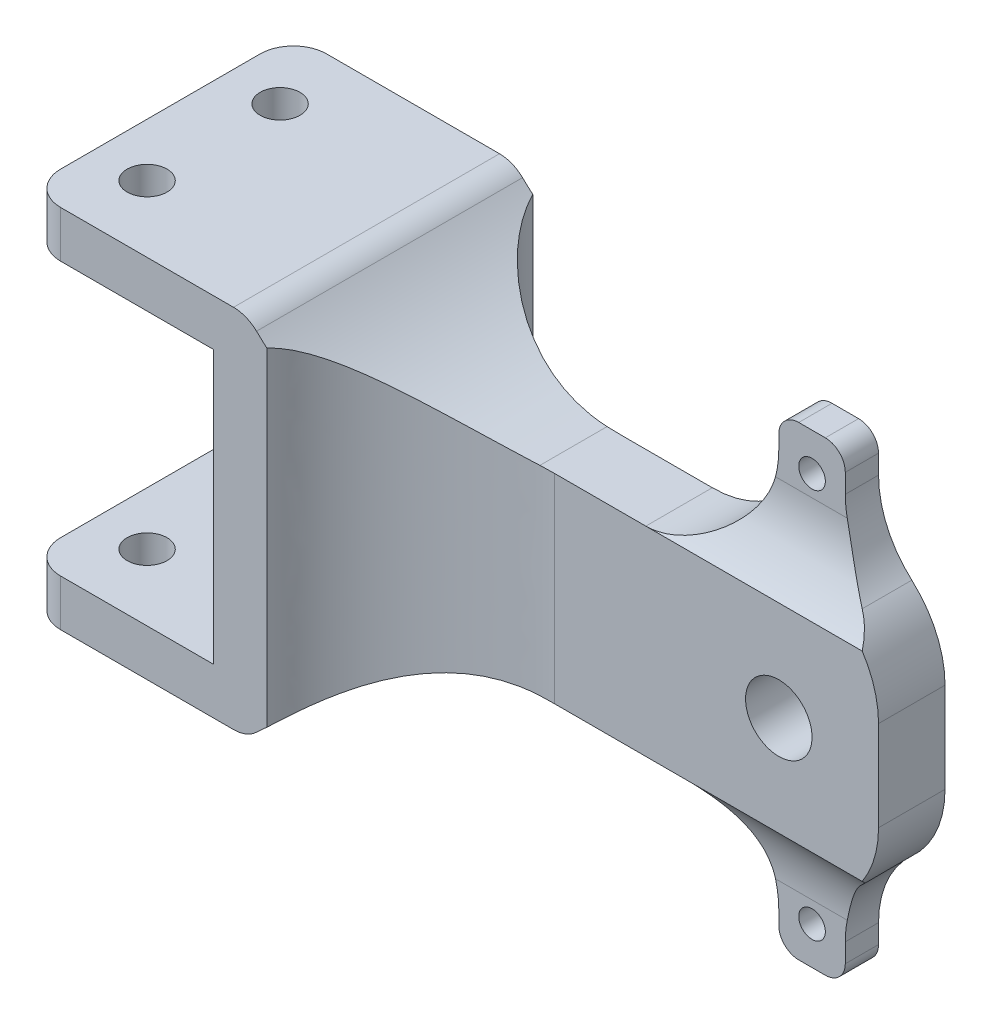
from build123d import *

# Parameters (mm, degrees)
SKETCH_1_W             = 85
SKETCH_1_H             = 30
EXTRUDE_1_DEPTH        = 10
CUT_EXTRUDE_1_REACH    = 92.692
SKETCH_2_R             = 5
EXTRUDE_2_DEPTH        = 15
EXTRUDE_2_DEPTH_BACK   = 25
SKETCH_3_W             = 8
SKETCH_3_H             = 30
SKETCH_5_W             = 8
SKETCH_5_H             = 40
EXTRUDE_3_DEPTH        = 12.5
SKETCH_6_W             = 40
SKETCH_6_H             = 7
EXTRUDE_4_DEPTH        = 28
CUT_EXTRUDE_2_REACH    = 100.266
SKETCH_7_R             = 3
FILLET_1_R             = 5
FILLET_1_OF_MIRROR_1_R = 5
FILLET_2_DEPTH         = 30
FILLET_3_DEPTH         = 30
FILLET_START           = 1e-07
FILLET_4_DEPTH         = 9.9999998
FILLET_START_2         = -15
FILLET_4_2_DEPTH       = 40
FILLET_START_3         = -11.111111111
FILLET_4_3_DEPTH       = 52.222222222
SKETCH_8_W             = 10
SKETCH_8_H             = 5
EXTRUDE_5_DEPTH        = 20
FILLET_5_R             = 15
SKETCH_9_R             = 2
CUT_EXTRUDE_3_DEPTH    = 20
FILLET_6_R             = 3
FILLET_6_OF_MIRROR_3_R = 3
FILLET_7_R             = 15
FILLET_8_R             = 15


with BuildPart() as part:
    # 草图1 → 凸台-拉伸1 (new body)
    with BuildSketch(Plane.XY):
        with Locations((42.5, 15)):
            Rectangle(SKETCH_1_W, SKETCH_1_H)
    extrude(amount=EXTRUDE_1_DEPTH)

    # 草图2 → 切除-拉伸1 (cut, up to next)
    with BuildSketch(Plane(origin=(0, 0, 0), x_dir=(-1, 0, 0), z_dir=(0, 0, -1)), mode=Mode.PRIVATE) as cut_extrude_1_sk1:
        with Locations((-70, 15)):
            Circle(SKETCH_2_R)
    cut_extrude_1_tool1 = extrude(cut_extrude_1_sk1.sketch, amount=-CUT_EXTRUDE_1_REACH, mode=Mode.PRIVATE) & part.part
    add(cut_extrude_1_tool1.solids().sort_by_distance((70, 15, 0))[0], mode=Mode.SUBTRACT)



with BuildPart() as body_2:
    # 草图3 → 凸台-拉伸2 (new, two sides: drawn at the far end of the back side and taken through both)
    with BuildSketch(Plane.XY.offset(10).offset(-EXTRUDE_2_DEPTH_BACK)):
        with Locations((4, 15)):
            Rectangle(SKETCH_3_W, SKETCH_3_H)
    extrude(amount=EXTRUDE_2_DEPTH + EXTRUDE_2_DEPTH_BACK)


with BuildPart() as part_1:
    add(part.part)

    add(body_2.part)  # 凸台-拉伸3 merges body 2
    # 草图5 → 凸台-拉伸3 (add)
    with BuildSketch(Plane(origin=(0, 30, 0), x_dir=(1, 0, 0), z_dir=(0, 1, 0))):
        with Locations((4, -5)):
            Rectangle(SKETCH_5_W, SKETCH_5_H)
    extrude_3 = extrude(amount=EXTRUDE_3_DEPTH)

    # 草图6 → 凸台-拉伸4 (add)
    with BuildSketch(Plane.ZY):
        with Locations((5, 39)):
            Rectangle(SKETCH_6_W, SKETCH_6_H)
    extrude_4 = extrude(amount=EXTRUDE_4_DEPTH)

    # 草图7 → 切除-拉伸2 (cut, up to next)
    with BuildSketch(Plane(origin=(0, 42.5, 0), x_dir=(1, 0, 0), z_dir=(0, 1, 0)), mode=Mode.PRIVATE) as cut_extrude_2_sk1:
        with Locations(Location((-20, 5, 0), (0, 0, 270))):
            Circle(SKETCH_7_R)
    cut_extrude_2_tool1 = extrude(cut_extrude_2_sk1.sketch, amount=-CUT_EXTRUDE_2_REACH, mode=Mode.PRIVATE) & part_1.part
    # 草图7 → 切除-拉伸2 (cut, up to next)
    with BuildSketch(Plane(origin=(0, 42.5, 0), x_dir=(1, 0, 0), z_dir=(0, 1, 0)), mode=Mode.PRIVATE) as cut_extrude_2_sk2:
        with Locations(Location((-20, -15, 0), (0, 0, 270))):
            Circle(SKETCH_7_R)
    cut_extrude_2_tool2 = extrude(cut_extrude_2_sk2.sketch, amount=-CUT_EXTRUDE_2_REACH, mode=Mode.PRIVATE) & part_1.part
    cut_extrude_2_1 = cut_extrude_2_tool1.solids().sort_by_distance((-20, 42.5, -5))[0]
    add(cut_extrude_2_1, mode=Mode.SUBTRACT)
    cut_extrude_2_2 = cut_extrude_2_tool2.solids().sort_by_distance((-20, 42.5, 15))[0]
    add(cut_extrude_2_2, mode=Mode.SUBTRACT)
    cut_extrude_2 = cut_extrude_2_1 + cut_extrude_2_2  # 切除-拉伸2 as one shape, for the pattern or mirror that repeats it

    # 圆角1
    fillet_1_edges = [part_1.edges().sort_by_distance(p)[0] for p in [
        (8, 42.5, 5),
        (-28, 39, -15),
        (-28, 39, 25),
    ]]
    fillet(fillet_1_edges, radius=FILLET_1_R)

    # 镜向1: 凸台-拉伸3, 凸台-拉伸4, 切除-拉伸2 across plane
    add(extrude_3.mirror(Plane.ZX.offset(15)))
    add(extrude_4.mirror(Plane.ZX.offset(15)))
    add(cut_extrude_2.mirror(Plane.ZX.offset(15)), mode=Mode.SUBTRACT)

    # 圆角1 of 镜向1
    fillet_1_of_mirror_1_edges = [part_1.edges().sort_by_distance(p)[0] for p in [
        (8, -12.5, 5),
        (-28, -9, -15),
        (-28, -9, 25),
    ]]
    fillet(fillet_1_of_mirror_1_edges, radius=FILLET_1_OF_MIRROR_1_R)

    # 圆角2: read off the stored shape, not the designer's step
    # 圆角2 outline → 圆角2 (add)
    with BuildSketch(Plane(origin=(0, 0, 0), x_dir=(1, 0, 0), z_dir=(0, 1, 0))):
        with BuildLine():
            add(Edge.make_bspline(
                [(36.284271247, -10), (13.303300859, -10), (8, -25)],
                knots=[0, 0, 0, 1, 1, 1], degree=2, weights=[1, 0.816496581, 1]))
            Line((36.284271247, -10), (8, -10))
            Line((8, -10), (8, -25))
        make_face()
    extrude(amount=FILLET_2_DEPTH)

    # 圆角3: read off the stored shape, not the designer's step
    # 圆角3 outline → 圆角3 (add)
    with BuildSketch(Plane(origin=(0, 0, 0), x_dir=(1, 0, 0), z_dir=(0, 1, 0))):
        with BuildLine():
            Line((8, 0), (36.284271247, 0))
            add(Edge.make_bspline(
                [(36.284271247, 0), (13.303300859, 0), (8, 15)],
                knots=[0, 0, 0, 1, 1, 1], degree=2, weights=[1, 0.816496581, 1]))
            Line((8, 15), (8, 0))
        make_face()
    extrude(amount=FILLET_3_DEPTH)

    # 圆角4: read off the stored shape, not the designer's step
    # 圆角4 outline → 圆角4 (add)
    with BuildSketch(Plane.XY.offset(FILLET_START)):
        with BuildLine():
            ThreePointArc((6.458305444, -11.111111111), (19.217640107, -2.881566512), (34.124772621, 0))
            Line((34.124772621, 0), (8, 0))
            Line((8, 0), (8, -7.5))
            ThreePointArc((8, -7.5), (7.598452306, -9.463220922), (6.458305444, -11.111111111))
        make_face()
        with BuildLine():
            ThreePointArc((34.124772621, 30), (19.217640107, 32.881566512), (6.458305444, 41.111111111))
            ThreePointArc((6.458305444, 41.111111111), (7.598452306, 39.463220922), (8, 37.5))
            Line((8, 37.5), (8, 30))
            Line((8, 30), (34.124772621, 30))
        make_face()
    extrude(amount=FILLET_4_DEPTH)

    # Fillet 4 2 outline → Fillet 4 2 (add)
    with BuildSketch(Plane.XY.offset(FILLET_START_2)):
        with BuildLine():
            ThreePointArc((6.458305444, -11.111111111), (19.217640107, -2.881566512), (34.124772621, 0))
            Line((34.124772621, 0), (8, 0))
            Line((8, 0), (8, -7.5))
            ThreePointArc((8, -7.5), (7.598452306, -9.463220922), (6.458305444, -11.111111111))
        make_face()
        with BuildLine():
            ThreePointArc((34.124772621, 30), (19.217640107, 32.881566512), (6.458305444, 41.111111111))
            ThreePointArc((6.458305444, 41.111111111), (7.598452306, 39.463220922), (8, 37.5))
            Line((8, 37.5), (8, 30))
            Line((8, 30), (34.124772621, 30))
        make_face()
    extrude(amount=FILLET_4_2_DEPTH)

    # Fillet 4 3 outline → Fillet 4 3 (cut)
    with BuildSketch(Plane(origin=(0, 0, 0), x_dir=(1, 0, 0), z_dir=(0, 1, 0)).offset(FILLET_START_3)):
        with BuildLine():
            Line((36, -25), (36, -10.000861536))
            add(Edge.make_bspline(
                [(36, -10.000861536), (13.254227526, -10.138800347), (8, -25)],
                knots=[0.007568185, 0.007568185, 0.007568185, 1, 1, 1], degree=2, weights=[0.997243446, 0.817885369, 1]))
            Line((8, -25), (36, -25))
        make_face()
        with BuildLine():
            add(Edge.make_bspline(
                [(36, 0.000861536), (13.254227526, 0.138800347), (8, 15)],
                knots=[0.007568185, 0.007568185, 0.007568185, 1, 1, 1], degree=2, weights=[0.997243446, 0.817885369, 1]))
            Line((36, 0.000861536), (36, 15))
            Line((36, 15), (8, 15))
        make_face()
    extrude(amount=FILLET_4_3_DEPTH, mode=Mode.SUBTRACT)

    # 草图8 → 凸台-拉伸5 (add)
    with BuildSketch(Plane(origin=(0, 30, 0), x_dir=(1, 0, 0), z_dir=(0, 1, 0))):
        with Locations((70, -2.5)):
            Rectangle(SKETCH_8_W, SKETCH_8_H)
    extrude_5 = extrude(amount=EXTRUDE_5_DEPTH)

    # 圆角5
    # the kernel refuses this fillet: 15 mm, written as the material it adds along each edge
    with BuildSketch(Plane(origin=(65, 30, 5), x_dir=(-1, 0, 0), z_dir=(0, 0, -1))) as fillet_5_piece_1:
        with BuildLine():
            CenterArc((FILLET_5_R, FILLET_5_R), FILLET_5_R, 180, 90)
            Line((0, FILLET_5_R), (-FILLET_5_R * 0.02, FILLET_5_R))
            Line((-FILLET_5_R * 0.02, FILLET_5_R), (-FILLET_5_R * 0.02, -FILLET_5_R * 0.02))
            Line((-FILLET_5_R * 0.02, -FILLET_5_R * 0.02), (FILLET_5_R, -FILLET_5_R * 0.02))
            Line((FILLET_5_R, -FILLET_5_R * 0.02), (FILLET_5_R, 0))
        make_face()
    extrude(amount=5)
    with BuildSketch(Plane(origin=(75, 30, 0), x_dir=(1, 0, 0), z_dir=(0, 0, 1))) as fillet_5_piece_2:
        with BuildLine():
            CenterArc((15, 14.142135624), FILLET_5_R, 180, 70.528779366)
            Line((0, 14.142135624), (-0.3, 14.142135624))
            Line((-0.3, 14.142135624), (-0.3, 0))
            Line((-0.3, 0), (0, -0.3))
            ThreePointArc((0, -0.3), (5, -0.3), (9.9, -0.282842712))
            Line((9.9, -0.282842712), (10, 0))
        make_face()
    extrude(amount=5)
    with BuildSketch(Plane(origin=(75, 30, 5), x_dir=(0, 0, 1), z_dir=(-1, 0, 0))) as fillet_5_piece_3:
        with BuildLine():
            CenterArc((15, 11.180339887), FILLET_5_R, 180, 48.189685104)
            Line((0, 11.180339887), (-0.3, 11.180339887))
            Line((-0.3, 11.180339887), (-0.3, 0))
            Line((-0.3, 0), (0, -0.3))
            ThreePointArc((0, -0.3), (2.5, -0.3), (4.8, -0.223606798))
            Line((4.8, -0.223606798), (5, 0))
        make_face()
    extrude(amount=10)
    with BuildSketch(Plane(origin=(65, 30, 42.5), x_dir=(-1, 0, 0), z_dir=(0, 0, -1))) as fillet_5_piece_4a_section:
        with BuildLine():
            CenterArc((FILLET_5_R, FILLET_5_R), FILLET_5_R, 180, 90)
            Line((0, FILLET_5_R), (-FILLET_5_R * 0.02, FILLET_5_R))
            Line((-FILLET_5_R * 0.02, FILLET_5_R), (-FILLET_5_R * 0.02, -FILLET_5_R * 0.02))
            Line((-FILLET_5_R * 0.02, -FILLET_5_R * 0.02), (FILLET_5_R, -FILLET_5_R * 0.02))
            Line((FILLET_5_R, -FILLET_5_R * 0.02), (FILLET_5_R, 0))
        make_face()
    fillet_5_piece_4a = extrude(amount=42.5, mode=Mode.PRIVATE)
    fillet_5_piece_4a = split(fillet_5_piece_4a, bisect_by=Plane(origin=(65, 30, 10), z_dir=(0, 0, -1)), keep=Keep.TOP, mode=Mode.PRIVATE)
    fillet_5_piece_4a = split(fillet_5_piece_4a, bisect_by=Plane(origin=(65, 30, 5), z_dir=(0, 0, 1)), keep=Keep.TOP, mode=Mode.PRIVATE)
    with BuildSketch(Plane(origin=(75, 30, 5), x_dir=(0, 0, 1), z_dir=(-1, 0, 0))) as fillet_5_piece_4b_section:
        with BuildLine():
            CenterArc((15, 11.180339887), FILLET_5_R, 180, 48.189685104)
            Line((0, 11.180339887), (-0.3, 11.180339887))
            Line((-0.3, 11.180339887), (-0.3, 0))
            Line((-0.3, 0), (0, -0.3))
            ThreePointArc((0, -0.3), (2.5, -0.3), (4.8, -0.223606798))
            Line((4.8, -0.223606798), (5, 0))
        make_face()
    fillet_5_piece_4b = extrude(amount=37.950849719, mode=Mode.PRIVATE)
    fillet_5_piece_4b = split(fillet_5_piece_4b, bisect_by=Plane(origin=(65, 30, 5), z_dir=(-1, 0, 0)), keep=Keep.TOP, mode=Mode.PRIVATE)
    fillet_5_piece_4 = fillet_5_piece_4a & fillet_5_piece_4b
    add(fillet_5_piece_4)
    with BuildSketch(Plane(origin=(102.950849719, 30, 5), x_dir=(0, 0, 1), z_dir=(-1, 0, 0))) as fillet_5_piece_5a_section:
        with BuildLine():
            CenterArc((15, 11.180339887), FILLET_5_R, 180, 48.189685104)
            Line((0, 11.180339887), (-0.3, 11.180339887))
            Line((-0.3, 11.180339887), (-0.3, 0))
            Line((-0.3, 0), (0, -0.3))
            ThreePointArc((0, -0.3), (2.5, -0.3), (4.8, -0.223606798))
            Line((4.8, -0.223606798), (5, 0))
        make_face()
    fillet_5_piece_5a = extrude(amount=37.950849719, mode=Mode.PRIVATE)
    fillet_5_piece_5a = split(fillet_5_piece_5a, bisect_by=Plane(origin=(85, 30, 5), z_dir=(-1, 0, 0)), keep=Keep.TOP, mode=Mode.PRIVATE)
    fillet_5_piece_5a = split(fillet_5_piece_5a, bisect_by=Plane(origin=(75, 30, 5), z_dir=(1, 0, 0)), keep=Keep.TOP, mode=Mode.PRIVATE)
    with BuildSketch(Plane(origin=(75, 30, 0), x_dir=(1, 0, 0), z_dir=(0, 0, 1))) as fillet_5_piece_5b_section:
        with BuildLine():
            CenterArc((15, 14.142135624), FILLET_5_R, 180, 70.528779366)
            Line((0, 14.142135624), (-0.3, 14.142135624))
            Line((-0.3, 14.142135624), (-0.3, 0))
            Line((-0.3, 0), (0, -0.3))
            ThreePointArc((0, -0.3), (5, -0.3), (9.9, -0.282842712))
            Line((9.9, -0.282842712), (10, 0))
        make_face()
    fillet_5_piece_5b = extrude(amount=40.355339059, mode=Mode.PRIVATE)
    fillet_5_piece_5b = split(fillet_5_piece_5b, bisect_by=Plane(origin=(75, 30, 10), z_dir=(0, 0, -1)), keep=Keep.TOP, mode=Mode.PRIVATE)
    fillet_5_piece_5b = split(fillet_5_piece_5b, bisect_by=Plane(origin=(75, 30, 5), z_dir=(0, 0, 1)), keep=Keep.TOP, mode=Mode.PRIVATE)
    fillet_5_piece_5 = fillet_5_piece_5a & fillet_5_piece_5b
    add(fillet_5_piece_5)

    # 草图9 → 切除-拉伸3 (cut)
    with BuildSketch(Plane.XY.offset(5)):
        with Locations((70, 44.33)):
            Circle(SKETCH_9_R)
    cut_extrude_3 = extrude(amount=-CUT_EXTRUDE_3_DEPTH, mode=Mode.SUBTRACT)

    # 圆角6
    fillet_6_edges = [part_1.edges().sort_by_distance(p)[0] for p in [
        (65, 50, 2.5),
        (75, 50, 2.5),
    ]]
    fillet(fillet_6_edges, radius=FILLET_6_R)

    # 镜向3: 凸台-拉伸5, 切除-拉伸3 across plane
    add(extrude_5.mirror(Plane.ZX.offset(15)))
    add(cut_extrude_3.mirror(Plane.ZX.offset(15)), mode=Mode.SUBTRACT)

    # 圆角6 of 镜向3
    fillet_6_of_mirror_3_edges = [part_1.edges().sort_by_distance(p)[0] for p in [
        (65, -20, 2.5),
        (75, -20, 2.5),
    ]]
    fillet(fillet_6_of_mirror_3_edges, radius=FILLET_6_OF_MIRROR_3_R)

    # 圆角7
    # the kernel refuses this fillet: 15 mm, written as the material it adds along each edge
    with BuildSketch(Plane(origin=(65, 0, 5), x_dir=(-1, 0, 0), z_dir=(0, 0, -1))) as fillet_7_piece_1:
        with BuildLine():
            CenterArc((FILLET_7_R, -FILLET_7_R), FILLET_7_R, 90, 90)
            Line((0, -FILLET_7_R), (-FILLET_7_R * 0.02, -FILLET_7_R))
            Line((-FILLET_7_R * 0.02, -FILLET_7_R), (-FILLET_7_R * 0.02, FILLET_7_R * 0.02))
            Line((-FILLET_7_R * 0.02, FILLET_7_R * 0.02), (FILLET_7_R, FILLET_7_R * 0.02))
            Line((FILLET_7_R, FILLET_7_R * 0.02), (FILLET_7_R, 0))
        make_face()
    extrude(amount=5)
    with BuildSketch(Plane(origin=(75, 0, 0), x_dir=(0, -1, 0), z_dir=(0, 0, 1))) as fillet_7_piece_2:
        with BuildLine():
            CenterArc((14.142135624, 15), FILLET_7_R, 199.471220634, 70.528779366)
            Line((0, 10), (-0.282842712, 9.9))
            ThreePointArc((-0.282842712, 9.9), (-0.3, 5), (-0.3, 0))
            Line((-0.3, 0), (0, -0.3))
            Line((0, -0.3), (14.142135624, -0.3))
            Line((14.142135624, -0.3), (14.142135624, 0))
        make_face()
    extrude(amount=5)
    with BuildSketch(Plane(origin=(75, 0, 5), x_dir=(0, 0, 1), z_dir=(-1, 0, 0))) as fillet_7_piece_3:
        with BuildLine():
            CenterArc((15, -11.180339887), FILLET_7_R, 131.810314896, 48.189685104)
            Line((0, -11.180339887), (-0.3, -11.180339887))
            Line((-0.3, -11.180339887), (-0.3, 0))
            Line((-0.3, 0), (0, 0.3))
            ThreePointArc((0, 0.3), (2.5, 0.3), (4.8, 0.223606798))
            Line((4.8, 0.223606798), (5, 0))
        make_face()
    extrude(amount=10)
    with BuildSketch(Plane(origin=(65, 0, 42.5), x_dir=(-1, 0, 0), z_dir=(0, 0, -1))) as fillet_7_piece_4a_section:
        with BuildLine():
            CenterArc((FILLET_7_R, -FILLET_7_R), FILLET_7_R, 90, 90)
            Line((0, -FILLET_7_R), (-FILLET_7_R * 0.02, -FILLET_7_R))
            Line((-FILLET_7_R * 0.02, -FILLET_7_R), (-FILLET_7_R * 0.02, FILLET_7_R * 0.02))
            Line((-FILLET_7_R * 0.02, FILLET_7_R * 0.02), (FILLET_7_R, FILLET_7_R * 0.02))
            Line((FILLET_7_R, FILLET_7_R * 0.02), (FILLET_7_R, 0))
        make_face()
    fillet_7_piece_4a = extrude(amount=42.5, mode=Mode.PRIVATE)
    fillet_7_piece_4a = split(fillet_7_piece_4a, bisect_by=Plane(origin=(65, 0, 10), z_dir=(0, 0, -1)), keep=Keep.TOP, mode=Mode.PRIVATE)
    fillet_7_piece_4a = split(fillet_7_piece_4a, bisect_by=Plane(origin=(65, 0, 5), z_dir=(0, 0, 1)), keep=Keep.TOP, mode=Mode.PRIVATE)
    with BuildSketch(Plane(origin=(75, 0, 5), x_dir=(0, 0, 1), z_dir=(-1, 0, 0))) as fillet_7_piece_4b_section:
        with BuildLine():
            CenterArc((15, -11.180339887), FILLET_7_R, 131.810314896, 48.189685104)
            Line((0, -11.180339887), (-0.3, -11.180339887))
            Line((-0.3, -11.180339887), (-0.3, 0))
            Line((-0.3, 0), (0, 0.3))
            ThreePointArc((0, 0.3), (2.5, 0.3), (4.8, 0.223606798))
            Line((4.8, 0.223606798), (5, 0))
        make_face()
    fillet_7_piece_4b = extrude(amount=37.950849719, mode=Mode.PRIVATE)
    fillet_7_piece_4b = split(fillet_7_piece_4b, bisect_by=Plane(origin=(65, 0, 5), z_dir=(-1, 0, 0)), keep=Keep.TOP, mode=Mode.PRIVATE)
    fillet_7_piece_4 = fillet_7_piece_4a & fillet_7_piece_4b
    add(fillet_7_piece_4)
    with BuildSketch(Plane(origin=(75, 0, 0), x_dir=(0, -1, 0), z_dir=(0, 0, 1))) as fillet_7_piece_5a_section:
        with BuildLine():
            CenterArc((14.142135624, 15), FILLET_7_R, 199.471220634, 70.528779366)
            Line((0, 10), (-0.282842712, 9.9))
            ThreePointArc((-0.282842712, 9.9), (-0.3, 5), (-0.3, 0))
            Line((-0.3, 0), (0, -0.3))
            Line((0, -0.3), (14.142135624, -0.3))
            Line((14.142135624, -0.3), (14.142135624, 0))
        make_face()
    fillet_7_piece_5a = extrude(amount=40.355339059, mode=Mode.PRIVATE)
    fillet_7_piece_5a = split(fillet_7_piece_5a, bisect_by=Plane(origin=(75, 0, 5), z_dir=(0, 0, 1)), keep=Keep.TOP, mode=Mode.PRIVATE)
    fillet_7_piece_5a = split(fillet_7_piece_5a, bisect_by=Plane(origin=(75, 0, 10), z_dir=(0, 0, -1)), keep=Keep.TOP, mode=Mode.PRIVATE)
    with BuildSketch(Plane(origin=(102.950849719, 0, 5), x_dir=(0, 0, 1), z_dir=(-1, 0, 0))) as fillet_7_piece_5b_section:
        with BuildLine():
            CenterArc((15, -11.180339887), FILLET_7_R, 131.810314896, 48.189685104)
            Line((0, -11.180339887), (-0.3, -11.180339887))
            Line((-0.3, -11.180339887), (-0.3, 0))
            Line((-0.3, 0), (0, 0.3))
            ThreePointArc((0, 0.3), (2.5, 0.3), (4.8, 0.223606798))
            Line((4.8, 0.223606798), (5, 0))
        make_face()
    fillet_7_piece_5b = extrude(amount=37.950849719, mode=Mode.PRIVATE)
    fillet_7_piece_5b = split(fillet_7_piece_5b, bisect_by=Plane(origin=(75, 0, 5), z_dir=(1, 0, 0)), keep=Keep.TOP, mode=Mode.PRIVATE)
    fillet_7_piece_5b = split(fillet_7_piece_5b, bisect_by=Plane(origin=(85, 0, 5), z_dir=(-1, 0, 0)), keep=Keep.TOP, mode=Mode.PRIVATE)
    fillet_7_piece_5 = fillet_7_piece_5a & fillet_7_piece_5b
    add(fillet_7_piece_5)

    # 圆角8
    fillet_8_edges = [part_1.edges().sort_by_distance(p)[0] for p in [
        (85, 30, 5),
        (85, 0, 5),
    ]]
    fillet(fillet_8_edges, radius=FILLET_8_R)


solid = part_1.part
